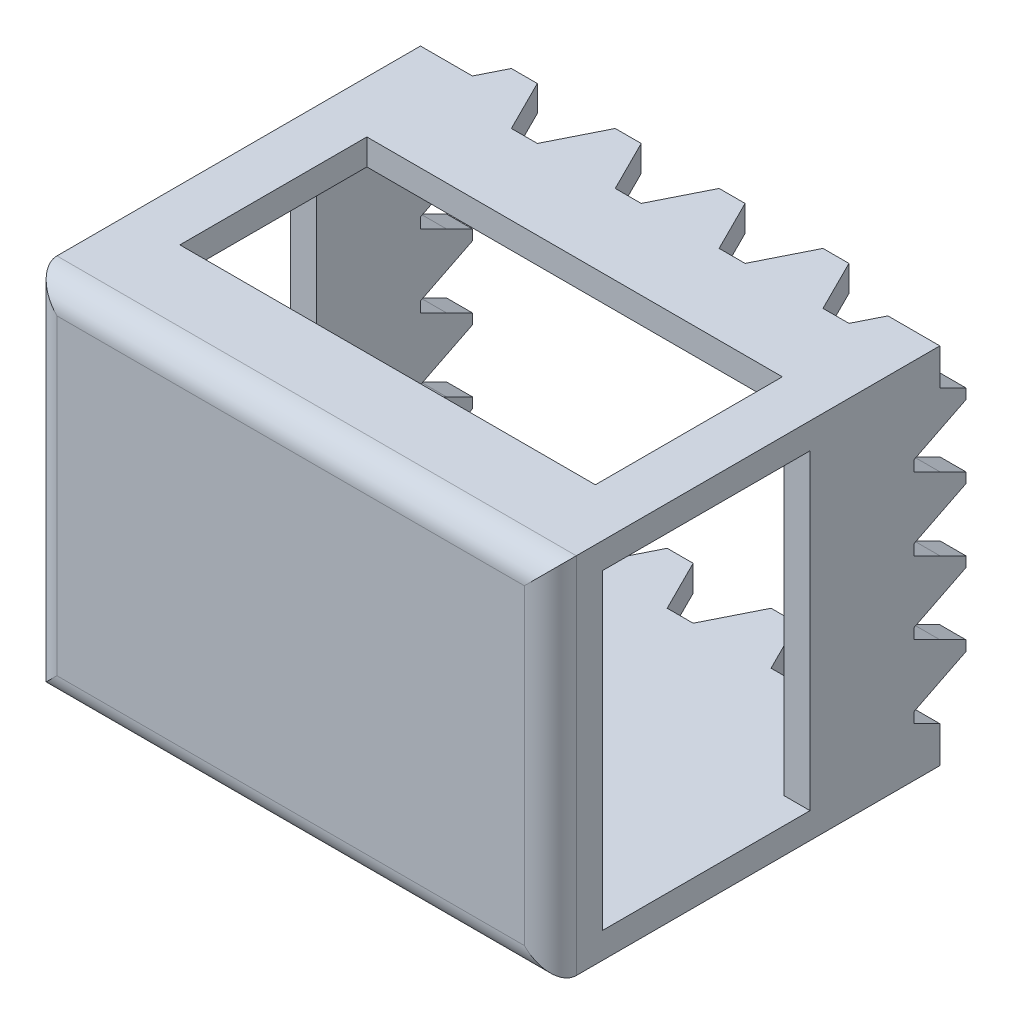
from build123d import *

# Parameters (mm, degrees)
SKETCH1_W               = 100
SKETCH1_H               = 70
BOSS_EXTRUDE1_DEPTH     = 80
FILLET2_R               = 5
CUT_EXTRUDE1_START      = -5
SKETCH3_W               = 90
SKETCH3_H               = 60
CUT_EXTRUDE1_DEPTH      = 75
SKETCH2_W               = 40
SKETCH2_H               = 60
CUT_EXTRUDE2_DEPTH      = 5
SKETCH4_W               = 40
SKETCH4_H               = 60
CUT_EXTRUDE3_DEPTH      = 5
CUT_EXTRUDE4_START      = -5
CUT_EXTRUDE4_DEPTH      = 5
CUT_EXTRUDE5_START      = -5
CUT_EXTRUDE5_DEPTH      = 5
CUT_EXTRUDE6_DEPTH      = 118.633373344
CUT_EXTRUDE6_DEPTH_BACK = 5
CUT_EXTRUDE7_DEPTH      = 118.633373344
CUT_EXTRUDE7_DEPTH_BACK = 5
SKETCH9_W               = 80
SKETCH9_H               = 36
CUT_EXTRUDE8_DEPTH      = 5


# Read off the part's stored shape, not the designer's step: Cut-Extrude4, Cut-Extrude5
with BuildPart() as part:
    # Sketch1 → Boss-Extrude1 (new body)
    with BuildSketch(Plane.XY):
        with Locations((-0.374701232, -1.49844749)):
            Rectangle(SKETCH1_W, SKETCH1_H)
    extrude(amount=-BOSS_EXTRUDE1_DEPTH)

    # Fillet2
    fillet2_edges = [part.edges().sort_by_distance(p)[0] for p in [
        (-0.374701232, 33.50155251, 0),
        (49.625298768, -1.49844749, 0),
        (-0.374701232, -36.49844749, 0),
        (-50.374701232, -1.49844749, 0),
    ]]
    fillet(fillet2_edges, radius=FILLET2_R)

    # Sketch3 → Cut-Extrude1 (cut)
    with BuildSketch(Plane.XY.offset(CUT_EXTRUDE1_START)):
        with Locations((-0.374701232, -1.49844749)):
            Rectangle(SKETCH3_W, SKETCH3_H)
    extrude(amount=-CUT_EXTRUDE1_DEPTH, mode=Mode.SUBTRACT)

    # Sketch2 → Cut-Extrude2 (cut)
    with BuildSketch(Plane(origin=(49.625298768, 0, 0), x_dir=(0, 0, -1), z_dir=(1, 0, 0))):
        with Locations((30, -1.49844749)):
            Rectangle(SKETCH2_W, SKETCH2_H)
    extrude(amount=-CUT_EXTRUDE2_DEPTH, mode=Mode.SUBTRACT)

    # Sketch4 → Cut-Extrude3 (cut)
    with BuildSketch(Plane.ZY.offset(50.374701232)):
        with Locations((-30, -1.49844749)):
            Rectangle(SKETCH4_W, SKETCH4_H)
    extrude(amount=-CUT_EXTRUDE3_DEPTH, mode=Mode.SUBTRACT)

    # Cut-Extrude4 outline → Cut-Extrude4 (cut)
    with BuildSketch(Plane(origin=(49.625298768, 0, 0), x_dir=(0, 0, -1), z_dir=(1, 0, 0)).offset(CUT_EXTRUDE4_START)):
        Polygon((80, -19.99844749), (70, -24.99844749), (70, -26.99844749), (75, -29.49844749), (75, -36.49844749), (80, -36.49844749), align=None)
        Polygon((75, 26.50155251), (80, 24.00155251), (80, 33.50155251), (75, 33.50155251), align=None)
        Polygon((70, 15.00155251), (80, 10.00155251), (80, 22.00155251), (70, 17.00155251), align=None)
        Polygon((70, 1.00155251), (80, -3.99844749), (80, 8.00155251), (70, 3.00155251), align=None)
        Polygon((70, -12.99844749), (80, -17.99844749), (80, -5.99844749), (70, -10.99844749), align=None)
    extrude(amount=CUT_EXTRUDE4_DEPTH, mode=Mode.SUBTRACT)

    # Cut-Extrude5 outline → Cut-Extrude5 (cut)
    with BuildSketch(Plane.ZY.offset(50.374701232).offset(CUT_EXTRUDE5_START)):
        Polygon((-80, 17.00155251), (-70, 22.00155251), (-70, 24.00155251), (-75, 26.50155251), (-75, 33.50155251), (-80, 33.50155251), align=None)
        Polygon((-75, -29.49844749), (-80, -26.99844749), (-80, -36.49844749), (-75, -36.49844749), align=None)
        Polygon((-70, -17.99844749), (-80, -12.99844749), (-80, -24.99844749), (-70, -19.99844749), align=None)
        Polygon((-70, -3.99844749), (-80, 1.00155251), (-80, -10.99844749), (-70, -5.99844749), align=None)
        Polygon((-70, 10.00155251), (-80, 15.00155251), (-80, 3.00155251), (-70, 8.00155251), align=None)
    extrude(amount=CUT_EXTRUDE5_DEPTH, mode=Mode.SUBTRACT)

    # Sketch7 → Cut-Extrude6 (cut, two sides: drawn at the far end of the back side and taken through both)
    with BuildSketch(Plane(origin=(0, 33.50155251, 0), x_dir=(1, 0, 0), z_dir=(0, 1, 0)).offset(-CUT_EXTRUDE6_DEPTH_BACK)):
        Polygon((-297.449069971, 75), (-45.374701232, 75), (-40.374701232, 75), (-37.874701232, 80), (-32.874701232, 80), (-27.874701232, 70), (-22.874701232, 70), (-17.874701232, 80), (-12.874701232, 80), (-7.874701232, 70), (-2.874701232, 70), (2.125298768, 80), (7.125298768, 80), (12.125298768, 70), (17.125298768, 70), (22.125298768, 80), (27.125298768, 80), (32.125298768, 70), (37.125298768, 70), (39.625298768, 75), (44.625298768, 75), (296.699667506, 75), (296.699667506, 579.148737476), (-297.449069971, 579.148737476), align=None)
    extrude(amount=CUT_EXTRUDE6_DEPTH + CUT_EXTRUDE6_DEPTH_BACK, mode=Mode.SUBTRACT)

    # Sketch8 → Cut-Extrude7 (cut, two sides: drawn at the far end of the back side and taken through both)
    with BuildSketch(Plane.XZ.offset(36.49844749).offset(-CUT_EXTRUDE7_DEPTH_BACK)):
        Polygon((-297.449069971, -75), (-45.374701232, -75), (-40.374701232, -75), (-37.874701232, -70), (-32.874701232, -70), (-27.874701232, -80), (-22.874701232, -80), (-17.874701232, -70), (-12.874701232, -70), (-7.874701232, -80), (-2.874701232, -80), (2.125298768, -70), (7.125298768, -70), (12.125298768, -80), (17.125298768, -80), (22.125298768, -70), (27.125298768, -70), (32.125298768, -80), (37.125298768, -80), (39.625298768, -75), (44.625298768, -75), (296.699667506, -75), (296.699667506, -579.148737476), (-297.449069971, -579.148737476), align=None)
    extrude(amount=CUT_EXTRUDE7_DEPTH + CUT_EXTRUDE7_DEPTH_BACK, mode=Mode.SUBTRACT)

    # Sketch9 → Cut-Extrude8 (cut)
    with BuildSketch(Plane(origin=(0, 33.50155251, 0), x_dir=(1, 0, 0), z_dir=(0, 1, 0))):
        with Locations((-0.374701232, 36.675611874)):
            Rectangle(SKETCH9_W, SKETCH9_H)
    extrude(amount=-CUT_EXTRUDE8_DEPTH, mode=Mode.SUBTRACT)


solid = part.part
